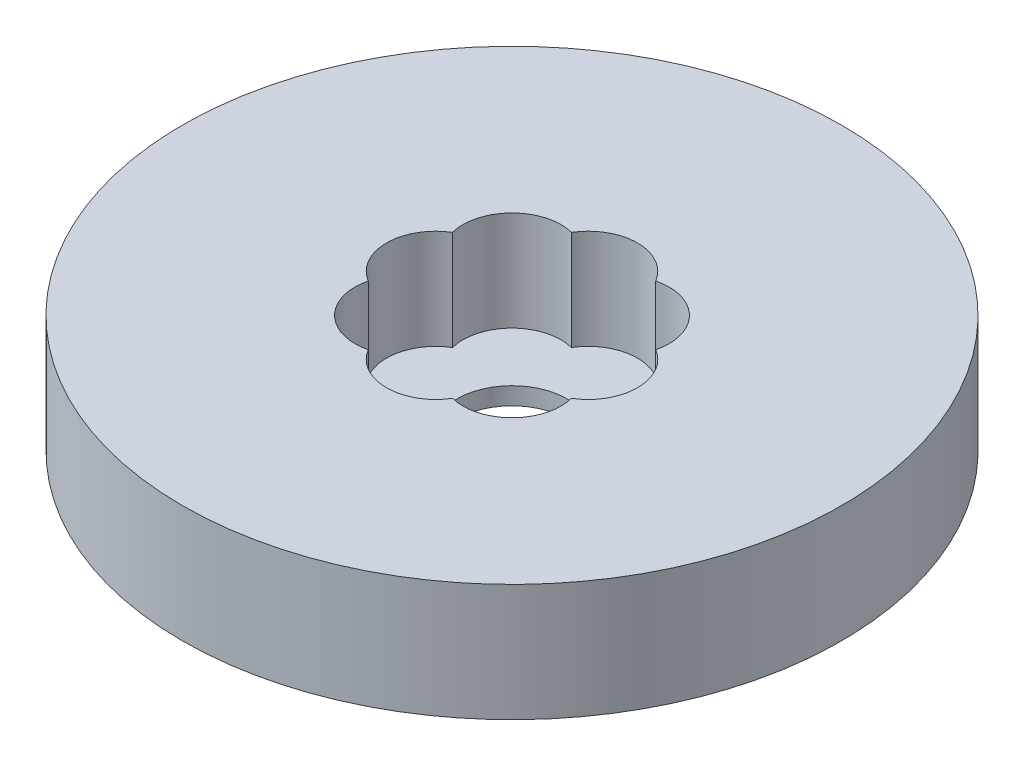
from build123d import *

# Parameters (mm, degrees)
SKETCH1_R           = 45
BOSS_EXTRUDE1_DEPTH = 16
SKETCH2_R           = 7.5
CUT_EXTRUDE1_DEPTH  = 66.620118866
SKETCH3_R           = 6.700020908
CUT_EXTRUDE2_DEPTH  = 13.617825353
CIRPATTERN1_COUNT   = 8


with BuildPart() as part:
    # Sketch1 → Boss-Extrude1 (new body)
    with BuildSketch(Plane(origin=(0, 0, 0), x_dir=(1, 0, 0), z_dir=(0, 1, 0))):
        Circle(SKETCH1_R)
    extrude(amount=BOSS_EXTRUDE1_DEPTH)

    # Sketch2 → Cut-Extrude1 (cut, through all)
    with BuildSketch(Plane(origin=(0, 0, 0), x_dir=(1, 0, 0), z_dir=(0, 1, 0))):
        Circle(SKETCH2_R)
    extrude(amount=CUT_EXTRUDE1_DEPTH, mode=Mode.SUBTRACT)

    # Sketch3 → Cut-Extrude2 (cut)
    with BuildSketch(Plane(origin=(0, 16, 0), x_dir=(1, 0, 0), z_dir=(0, 1, 0))):
        with Locations((-10.430928244, 0)):
            Circle(SKETCH3_R)
    cut_extrude2 = extrude(amount=-CUT_EXTRUDE2_DEPTH, mode=Mode.SUBTRACT)

    # CirPattern1: Cut-Extrude2 ×8 about axis
    cirpattern1_axis = Axis((0, 0, 0), (0, 1, 0))
    for i in range(1, CIRPATTERN1_COUNT):
        add(cut_extrude2.rotate(cirpattern1_axis, i * 360 / CIRPATTERN1_COUNT), mode=Mode.SUBTRACT)


solid = part.part
